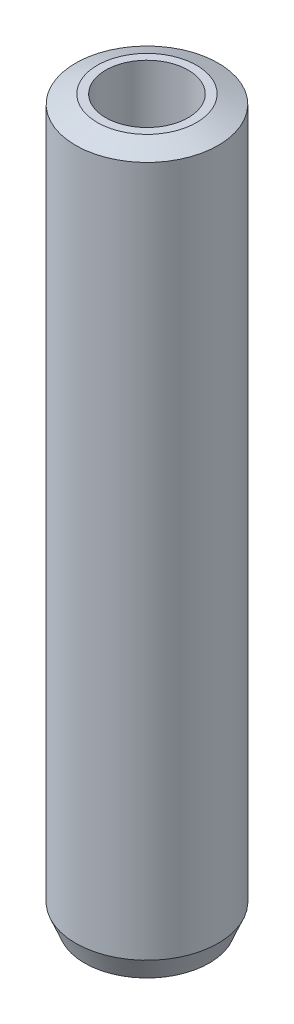
from build123d import *
from OCP.BRepFilletAPI import BRepFilletAPI_MakeChamfer

# Parameters (mm, degrees)
SKETCH1_R           = 47.5
BOSS_EXTRUDE1_DEPTH = 480.630335309
SKETCH2_R           = 27.480002683
CUT_EXTRUDE1_DEPTH  = 486.301987652
CHAMFER1_SIZE       = 5.960292943
CHAMFER1_SIZE2      = 14.441341342


with BuildPart() as part:
    # Sketch1 → Boss-Extrude1 (new body)
    with BuildSketch(Plane(origin=(0, 0, 0), x_dir=(1, 0, 0), z_dir=(0, 1, 0))):
        Circle(SKETCH1_R)
    extrude(amount=BOSS_EXTRUDE1_DEPTH)

    # Sketch2 → Cut-Extrude1 (cut, through all)
    with BuildSketch(Plane(origin=(0, 0, 0), x_dir=(1, 0, 0), z_dir=(0, 1, 0))):
        Circle(SKETCH2_R)
    extrude(amount=CUT_EXTRUDE1_DEPTH, mode=Mode.SUBTRACT)

    # Chamfer1: one chamfer whose edges measure the first distance from different faces: ONE call of the kernel's chamfer builder (chamfer() names one face for all edges)
    chamfer1_edges_1 = [part.edges().sort_by_distance(p)[0] for p in [
        (-47.5, 480.630335309, 0),
    ]]
    chamfer1_side_1 = [part.faces().sort_by_distance(p)[0] for p in [
        (-47.5, 240.315167655, 0),
    ]]
    chamfer1_edges_2 = [part.edges().sort_by_distance(p)[0] for p in [
        (-47.5, 0, 0),
    ]]
    chamfer1_side_2 = [part.faces().sort_by_distance(p)[0] for p in [
        (-46.156497116, 0, 0),
    ]]
    chamfer1 = BRepFilletAPI_MakeChamfer(part.part.solid().wrapped)
    for e in chamfer1_edges_1:
        chamfer1.Add(CHAMFER1_SIZE, CHAMFER1_SIZE2, e.wrapped, chamfer1_side_1[0].wrapped)  # the first distance lies on this face
    for e in chamfer1_edges_2:
        chamfer1.Add(CHAMFER1_SIZE, CHAMFER1_SIZE2, e.wrapped, chamfer1_side_2[0].wrapped)  # the first distance lies on this face
    add(Compound.cast(chamfer1.Shape()), mode=Mode.REPLACE)


solid = part.part
